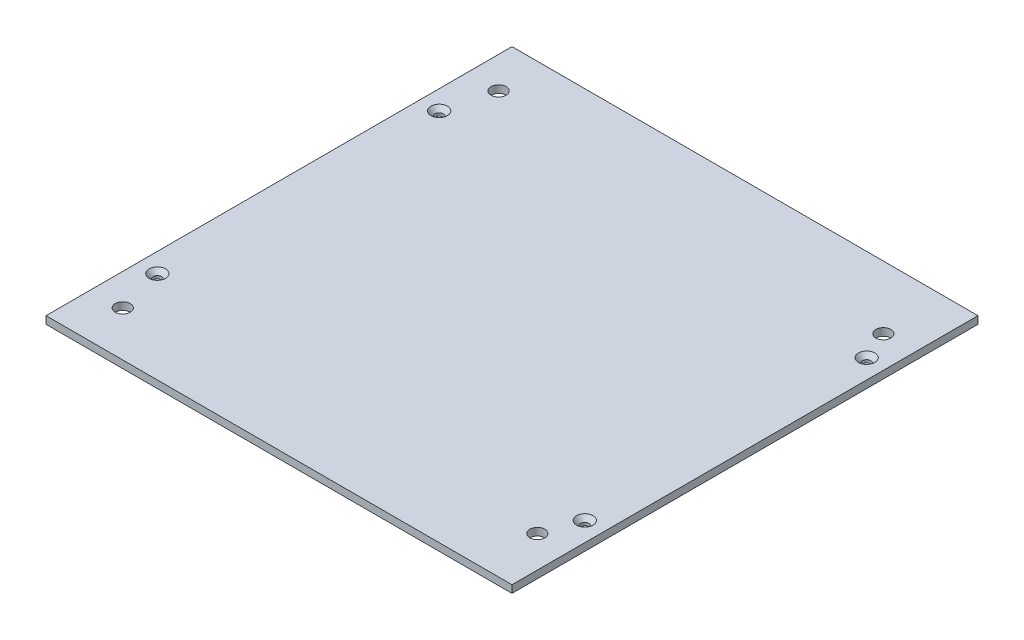
from build123d import *

# Parameters (mm, degrees)
SKETCH1_W                                     = 99.2004
SKETCH1_H                                     = 99.2004
BOSS_EXTRUDE1_DEPTH                           = 1.6002
CSK_FOR_0_FLAT_HEAD_SOCKET_CAP_SCREW1_A_COUNT = 2
CSK_FOR_0_FLAT_HEAD_SOCKET_CAP_SCREW1_A_PITCH = 60
CSK_FOR_0_FLAT_HEAD_SOCKET_CAP_SCRE_2_COUNT   = 2
CSK_FOR_0_FLAT_HEAD_SOCKET_CAP_SCRE_2_PITCH   = 109
CSK_FOR_0_FLAT_HEAD_SOCKET_CAP_SCRE_3_COUNT   = 2
CSK_FOR_0_FLAT_HEAD_SOCKET_CAP_SCRE_3_PITCH   = 91
SKETCH7_R                                     = 1.6
CUT_EXTRUDE1_DEPTH                            = 10


with BuildPart() as part:
    # Sketch1 → Boss-Extrude1 (new body)
    with BuildSketch(Plane(origin=(0, 0, 0), x_dir=(1, 0, 0), z_dir=(0, 1, 0))):
        with Locations((49.6002, 49.6002)):
            Rectangle(SKETCH1_W, SKETCH1_H)
    extrude(amount=BOSS_EXTRUDE1_DEPTH)

    # Sketch5 → CSK for #0 Flat Head Socket Cap Screw1 (revolve, cut)
    with BuildSketch(Plane(origin=(4.1002, 1.6002, -79.6002), x_dir=(0, 0, 1), z_dir=(1, 0, 0))):
        Polygon((0, 0), (0, 1.6002), (0.889, 1.6002), (0.889, 0.993458156), (1.7526, 0), align=None)
    csk_for_0_flat_head_socket_cap_screw1 = revolve(axis=Axis((4.1002, 7.9502, -79.6002), (0, -1, 0)), mode=Mode.SUBTRACT)

    # CSK for #0 Flat Head Socket Cap Screw1 a: CSK for #0 Flat Head Socket Cap Screw1 ×2
    with Locations(*[(0, 0, i * CSK_FOR_0_FLAT_HEAD_SOCKET_CAP_SCREW1_A_PITCH) for i in range(1, CSK_FOR_0_FLAT_HEAD_SOCKET_CAP_SCREW1_A_COUNT)]):
        add(csk_for_0_flat_head_socket_cap_screw1, mode=Mode.SUBTRACT)

    # CSK for _0 Flat Head Socket Cap Scre 2: CSK for #0 Flat Head Socket Cap Screw1 ×2
    with Locations(*[Vector(0.8348623853211011, 0, 0.5504587155963301) * (i * CSK_FOR_0_FLAT_HEAD_SOCKET_CAP_SCRE_2_PITCH) for i in range(1, CSK_FOR_0_FLAT_HEAD_SOCKET_CAP_SCRE_2_COUNT)]):
        add(csk_for_0_flat_head_socket_cap_screw1, mode=Mode.SUBTRACT)

    # CSK for _0 Flat Head Socket Cap Scre 3: CSK for #0 Flat Head Socket Cap Screw1 ×2
    with Locations(*[(i * CSK_FOR_0_FLAT_HEAD_SOCKET_CAP_SCRE_3_PITCH, 0, 0) for i in range(1, CSK_FOR_0_FLAT_HEAD_SOCKET_CAP_SCRE_3_COUNT)]):
        add(csk_for_0_flat_head_socket_cap_screw1, mode=Mode.SUBTRACT)

    # Sketch7 → Cut-Extrude1 (cut)
    with BuildSketch(Plane(origin=(0, 1.6002, 0), x_dir=(1, 0, 0), z_dir=(0, 1, 0))):
        with Locations((6.7377, 9.5952)):
            Circle(SKETCH7_R)
        with Locations((6.7377, 89.6052)):
            Circle(SKETCH7_R)
        with Locations((92.4627, 85.7952)):
            Circle(SKETCH7_R)
        with Locations((92.4627, 12.1352)):
            Circle(SKETCH7_R)
    extrude(amount=-CUT_EXTRUDE1_DEPTH, mode=Mode.SUBTRACT)


solid = part.part
